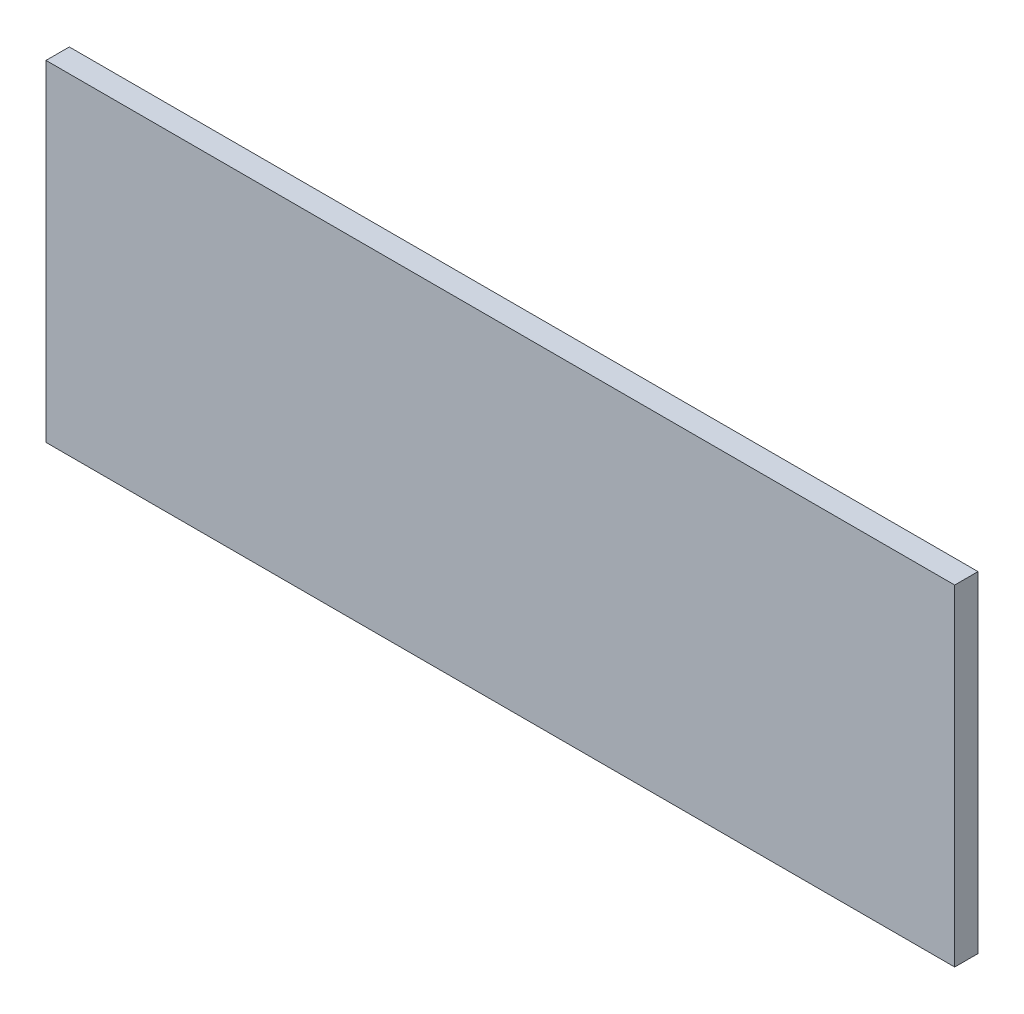
from build123d import *

# Parameters (mm, degrees)
SKETCH1_W           = 390
SKETCH1_H           = 142
BOSS_EXTRUDE1_DEPTH = 5


with BuildPart() as part:
    # Sketch1 → Boss-Extrude1 (new, symmetric)
    with BuildSketch(Plane.XY):
        Rectangle(SKETCH1_W, SKETCH1_H)
    extrude(amount=BOSS_EXTRUDE1_DEPTH, both=True)


solid = part.part
